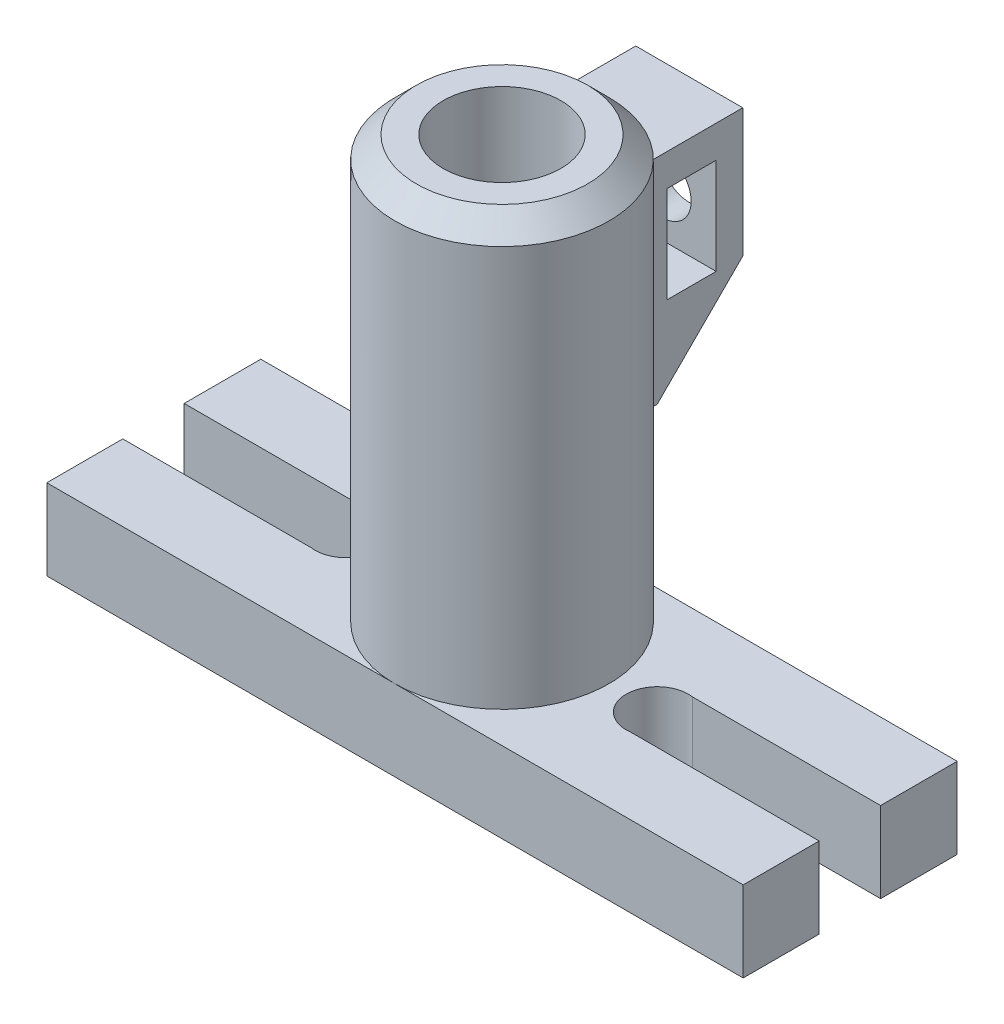
from build123d import *

# Parameters (mm, degrees)
SKETCH1_W                   = 82.6516
SKETCH1_H                   = 25.4
BOSS_EXTRUDE1_DEPTH         = 9.5758
SKETCH8_W                   = 2.902818519
SKETCH8_H                   = 9.580147983
BOSS_EXTRUDE4_DEPTH         = 25.4
SKETCH10_R                  = 12.7
BOSS_EXTRUDE5_DEPTH         = 50.1015
SKETCH12_R                  = 6.985
CUT_EXTRUDE2_DEPTH          = 50.8635
CHAMFER1_SIZE               = 2.54
SKETCH14_W                  = 12.7
SKETCH14_H                  = 25.4
BOSS_EXTRUDE6_DEPTH         = 15.24
CUT_EXTRUDE3_REACH          = 81.551
SKETCH18_W                  = 5.842
SKETCH18_H                  = 11.43
F_1_4_CLEARANCE_HOLE2_D     = 6.7564
F_1_4_CLEARANCE_HOLE2_DEPTH = 20.32
F_1_4_CLEARANCE_HOLE2_TIP   = 2.029827343
CHAMFER2_SIZE               = 10.16
SKETCH2_W                   = 22.86
SKETCH2_H                   = 7.2898
CUT_EXTRUDE1_DEPTH          = 69.64351887
SKETCH23_R                  = 3.683
CUT_EXTRUDE6_DEPTH          = 69.64351887


with BuildPart() as part:
    # Sketch1 → Boss-Extrude1 (new body)
    with BuildSketch(Plane(origin=(0, 0, 0), x_dir=(1, 0, 0), z_dir=(0, 1, 0))):
        Rectangle(SKETCH1_W, SKETCH1_H)
    extrude(amount=BOSS_EXTRUDE1_DEPTH)

    # Sketch8 → Boss-Extrude4 (add, through all)
    with BuildSketch(Plane.XY.offset(12.7)):
        with Locations((-1.45140926, 4.790073991)):
            Rectangle(SKETCH8_W, SKETCH8_H)
    extrude(amount=-BOSS_EXTRUDE4_DEPTH)

    # Sketch10 → Boss-Extrude5 (add)
    with BuildSketch(Plane(origin=(0, 9.5758, 0), x_dir=(1, 0, 0), z_dir=(0, 1, 0))):
        with Locations(Location((0, 0, 0), (0, 0, 270))):
            Circle(SKETCH10_R)
    extrude(amount=BOSS_EXTRUDE5_DEPTH)

    # Sketch12 → Cut-Extrude2 (cut)
    with BuildSketch(Plane(origin=(0, 59.6773, 0), x_dir=(1, 0, 0), z_dir=(0, 1, 0))):
        with Locations(Location((0, 0, 0), (0, 0, 270))):
            Circle(SKETCH12_R)
    extrude(amount=-CUT_EXTRUDE2_DEPTH, mode=Mode.SUBTRACT)

    # Chamfer1
    chamfer1_edges = [part.edges().sort_by_distance(p)[0] for p in [
        (0, 59.6773, -12.7),
    ]]
    chamfer(chamfer1_edges, length=CHAMFER1_SIZE)

    # Sketch14 → Boss-Extrude6 (add)
    with BuildSketch(Plane.XY.offset(-6.985)):
        with Locations((0, 41.790845474)):
            Rectangle(SKETCH14_W, SKETCH14_H)
    extrude(amount=-BOSS_EXTRUDE6_DEPTH)

    # Sketch18 → Cut-Extrude3 (cut, up to next)
    with BuildSketch(Plane(origin=(6.35, 0, 0), x_dir=(0, 0, -1), z_dir=(1, 0, 0)), mode=Mode.PRIVATE) as cut_extrude3_sk1:
        with Locations((16.149395763, 44.965845474)):
            Rectangle(SKETCH18_W, SKETCH18_H)
    cut_extrude3_tool1 = extrude(cut_extrude3_sk1.sketch, amount=-CUT_EXTRUDE3_REACH, mode=Mode.PRIVATE) & part.part
    add(cut_extrude3_tool1.solids().sort_by_distance((6.35, 44.965845, -16.149396))[0], mode=Mode.SUBTRACT)

    # 1/4 Clearance Hole2
    with Locations(Plane(origin=(0, 0, -22.225), x_dir=(-1, 0, 0), z_dir=(0, 0, -1))):
        with Locations((0, 44.965845474)):
            Hole(F_1_4_CLEARANCE_HOLE2_D / 2, depth=F_1_4_CLEARANCE_HOLE2_DEPTH)
            with Locations((0, 0, -(F_1_4_CLEARANCE_HOLE2_DEPTH + F_1_4_CLEARANCE_HOLE2_TIP / 2))):  # 118° drill point
                Cone(0, F_1_4_CLEARANCE_HOLE2_D / 2, F_1_4_CLEARANCE_HOLE2_TIP, mode=Mode.SUBTRACT)

    # Chamfer2
    # the kernel refuses this chamfer: 10.16 mm, written as the material it takes off along each edge
    with BuildSketch(Plane(origin=(32.478299158, 29.090845474, -22.225), x_dir=(0, -0.027495876610586265, 0.9996219169112968), z_dir=(-1, 0, 0))) as chamfer2_piece_1_section:
        Polygon((CHAMFER2_SIZE * 0.999621916911, CHAMFER2_SIZE * 0.0274958766106), (-CHAMFER2_SIZE * 0.0274958766106, CHAMFER2_SIZE * 0.999621916911), (0, 0), align=None)
    chamfer2_piece_1 = extrude(amount=64.956598315, mode=Mode.PRIVATE)
    chamfer2_piece_1 = chamfer2_piece_1 - Plane(origin=(0, 32.444576681, 0), x_dir=(0, 0, 1), z_dir=(0, -1, 0)) * Cylinder(12.7, 171, mode=Mode.PRIVATE)
    add(chamfer2_piece_1, mode=Mode.SUBTRACT)

    # Sketch2 → Cut-Extrude1 (cut, through all)
    with BuildSketch(Plane(origin=(0, 9.5758, 0), x_dir=(1, 0, 0), z_dir=(0, 1, 0))):
        with Locations((29.8958, -0.0381)):
            Rectangle(SKETCH2_W, SKETCH2_H)
    cut_extrude1 = extrude(amount=-CUT_EXTRUDE1_DEPTH, mode=Mode.SUBTRACT)

    # Sketch23 → Cut-Extrude6 (cut, through all)
    with BuildSketch(Plane(origin=(0, 9.5758, 0), x_dir=(1, 0, 0), z_dir=(0, 1, 0))):
        with Locations((18.4658, -0.0381)):
            Circle(SKETCH23_R)
    cut_extrude6 = extrude(amount=-CUT_EXTRUDE6_DEPTH, mode=Mode.SUBTRACT)

    # Mirror1: Cut-Extrude1, Cut-Extrude6 across plane
    add(cut_extrude1.mirror(Plane(origin=(0, 0, 0), x_dir=(0, 0, 1), z_dir=(1, 0, 0))), mode=Mode.SUBTRACT)
    add(cut_extrude6.mirror(Plane(origin=(0, 0, 0), x_dir=(0, 0, 1), z_dir=(1, 0, 0))), mode=Mode.SUBTRACT)


solid = part.part
